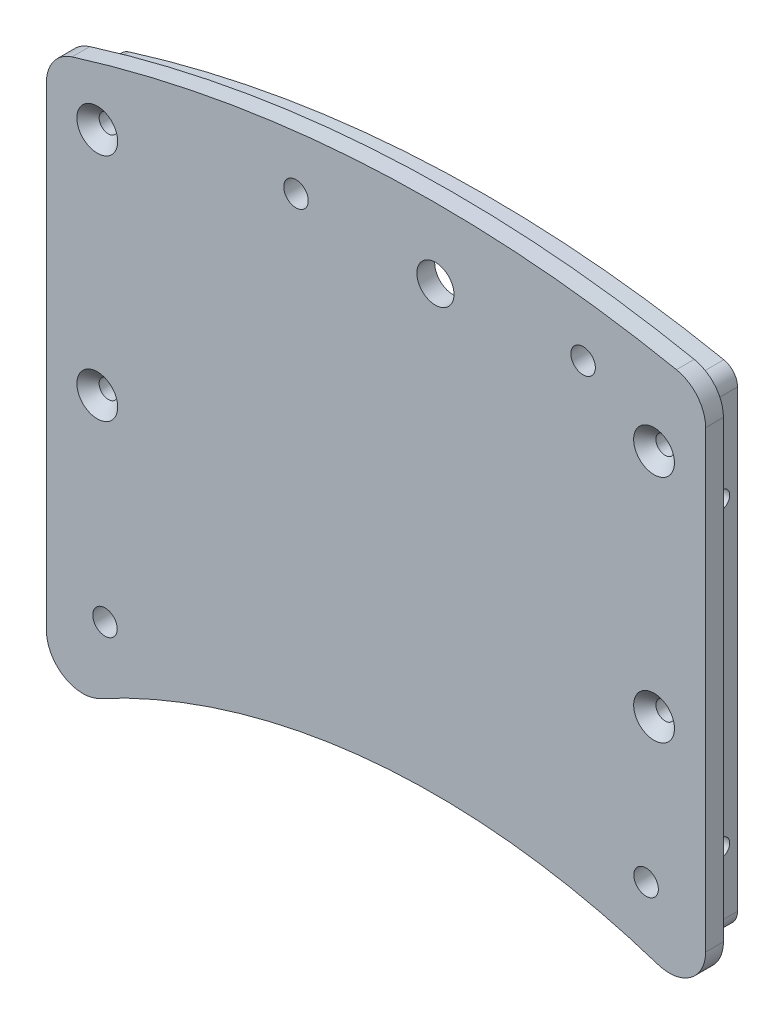
from build123d import *

# Parameters (mm, degrees)
EXTRUDE_446_DEPTH      = 4.5
EXTRUDE_871_DEPTH      = 2.4
SKETCH_7_R             = 1.25
SKETCH_7_R_2           = 2.5
CUT_EXTRUDE_1133_DEPTH = 3
CHAMFER_1178_SIZE      = 1.5
EXTRUDE_START          = 4.5
SKETCH_8_R             = 2.85
SKETCH_8_R_2           = 1.25
EXTRUDE_1547_DEPTH     = 4.5
SKETCH_9_R             = 1.65
CUT_EXTRUDE_1826_DEPTH = 3
SKETCH_13_R            = 1.2
CUT_EXTRUDE_2013_DEPTH = 5
CUT_EXTRUDE_START      = -7
SKETCH_14_R            = 1.2
CUT_EXTRUDE_2216_DEPTH = 7
FILLET_2261_R          = 2


with BuildPart() as part:
    # Эскиз1 → Extrude 446 (new body)
    with BuildSketch(Plane.XY):
        with BuildLine():
            ThreePointArc((-48.184740917, 154.510381185), (-49.352687792, 153.677592944), (-49.8, 152.314674038))
            Line((-49.8, 152.314674038), (-49.8, 88.338690467))
            ThreePointArc((-49.8, 88.338690467), (-48.67998968, 86.364450269), (-46.41076143, 86.312966069))
            ThreePointArc((-46.41076143, 86.312966069), (-8.509697807, 97.629257558), (30.777662843, 93.040971394))
            ThreePointArc((30.777662843, 93.040971394), (32.846964094, 93.360279245), (33.8, 95.224598888))
            Line((33.8, 95.224598888), (33.8, 156.408950918))
            ThreePointArc((33.8, 156.408950918), (33.279664307, 157.865932371), (31.954091345, 158.663679516))
            ThreePointArc((31.954091345, 158.663679516), (-8.376811335, 161.632472551), (-48.184740917, 154.510381185))
        make_face()
        with BuildLine():
            Line((-47.4, 152.241091851), (-47.4, 88.505842281))
            ThreePointArc((-47.4, 88.505842281), (-8.703725392, 100.021444112), (31.4, 95.362907453))
            Line((31.4, 95.362907453), (31.4, 156.32706115))
            ThreePointArc((31.4, 156.32706115), (-8.256741868, 159.235474256), (-47.4, 152.241091851))
        make_face(mode=Mode.SUBTRACT)
    extrude(amount=-EXTRUDE_446_DEPTH)

    # Эскиз2 → Extrude 871 (add)
    with BuildSketch(Plane.XY):
        with BuildLine():
            Line((-52.4, 152.314674038), (-52.4, 88.338690467))
            ThreePointArc((-52.4, 88.338690467), (-50.013891057, 84.132700481), (-45.179448263, 84.023016749))
            ThreePointArc((-45.179448263, 84.023016749), (-8.283928985, 95.039078329), (29.961107796, 90.572522923))
            ThreePointArc((29.961107796, 90.572522923), (34.369619156, 91.252787475), (36.4, 95.224598888))
            Line((36.4, 95.224598888), (36.4, 156.408950918))
            ThreePointArc((36.4, 156.408950918), (35.291458741, 159.512954882), (32.467411995, 161.212503148))
            ThreePointArc((32.467411995, 161.212503148), (-8.511379087, 164.228987816), (-48.958795866, 156.992484917))
            ThreePointArc((-48.958795866, 156.992484917), (-51.447030513, 155.218283882), (-52.4, 152.314674038))
        make_face()
    extrude(amount=EXTRUDE_871_DEPTH)

    # Эскиз7 → Cut-Extrude 1133 (cut)
    with BuildSketch(Plane(origin=(0, 0, 0), x_dir=(-1, 0, 0), z_dir=(0, 0, -1))):
        with Locations((-29.451383649, 150.200294851)):
            Circle(SKETCH_7_R)
        with Locations((45.554851126, 150.200369953)):
            Circle(SKETCH_7_R)
        with Locations((45.55089452, 119.209232592)):
            Circle(SKETCH_7_R)
        with Locations((-29.454420734, 119.20872198)):
            Circle(SKETCH_7_R)
        with Locations((0, 155)):
            Circle(SKETCH_7_R_2)
    extrude(amount=-CUT_EXTRUDE_1133_DEPTH, mode=Mode.SUBTRACT)

    # Chamfer 1178
    chamfer_1178_edges = [part.edges().sort_by_distance(p)[0] for p in [
        (30.704420734, 119.20872198, 2.4),
        (-44.30089452, 119.209232592, 2.4),
        (-44.304851126, 150.200369953, 2.4),
        (30.701383649, 150.200294851, 2.4),
    ]]
    chamfer(chamfer_1178_edges, length=CHAMFER_1178_SIZE)

    # Эскиз8 → Extrude 1547 (add)
    # profile 1 of 4: a face of its own
    with BuildSketch(Plane(origin=(0, 0, 0), x_dir=(-1, 0, 0), z_dir=(0, 0, -1)).offset(EXTRUDE_START)):
        with Locations((-29.454420734, 119.20872198)):
            Circle(SKETCH_8_R)
        with Locations((-29.454420734, 119.20872198)):
            Circle(SKETCH_8_R_2, mode=Mode.SUBTRACT)
    # profile 2 of 4: a face of its own
    with BuildSketch(Plane(origin=(0, 0, 0), x_dir=(-1, 0, 0), z_dir=(0, 0, -1)).offset(EXTRUDE_START)):
        with Locations((-29.451383649, 150.200294851)):
            Circle(SKETCH_8_R)
        with Locations((-29.451383649, 150.200294851)):
            Circle(SKETCH_8_R_2, mode=Mode.SUBTRACT)
    # profile 3 of 4: a face of its own
    with BuildSketch(Plane(origin=(0, 0, 0), x_dir=(-1, 0, 0), z_dir=(0, 0, -1)).offset(EXTRUDE_START)):
        with Locations((45.55089452, 119.209232592)):
            Circle(SKETCH_8_R)
        with Locations((45.55089452, 119.209232592)):
            Circle(SKETCH_8_R_2, mode=Mode.SUBTRACT)
    # profile 4 of 4: a face of its own
    with BuildSketch(Plane(origin=(0, 0, 0), x_dir=(-1, 0, 0), z_dir=(0, 0, -1)).offset(EXTRUDE_START)):
        with Locations((45.554851126, 150.200369953)):
            Circle(SKETCH_8_R)
        with Locations((45.554851126, 150.200369953)):
            Circle(SKETCH_8_R_2, mode=Mode.SUBTRACT)
    extrude(amount=-EXTRUDE_1547_DEPTH)

    # Эскиз9 → Cut-Extrude 1826 (cut)
    with BuildSketch(Plane(origin=(0, 0, 0), x_dir=(-1, 0, 0), z_dir=(0, 0, -1))):
        with Locations((-28.380750513, 99.381741539)):
            Circle(SKETCH_9_R)
        with Locations((44.512478568, 93.278276156)):
            Circle(SKETCH_9_R)
        with Locations((-19.894937989, 155.969982116)):
            Circle(SKETCH_9_R)
        with Locations((18.78344627, 156.107738518)):
            Circle(SKETCH_9_R)
    extrude(amount=-CUT_EXTRUDE_1826_DEPTH, mode=Mode.SUBTRACT)

    # Эскиз13 → Cut-Extrude 2013 (cut)
    with BuildSketch(Plane.ZY.offset(49.8)):
        with Locations((-2.25, 144.314674038)):
            Circle(SKETCH_13_R)
        with Locations((-2.25, 91.438690467)):
            Circle(SKETCH_13_R)
    extrude(amount=-CUT_EXTRUDE_2013_DEPTH, mode=Mode.SUBTRACT)

    # Эскиз14 → Cut-Extrude 2216 (cut)
    with BuildSketch(Plane(origin=(33.8, 0, 0), x_dir=(0, 0, -1), z_dir=(1, 0, 0)).offset(CUT_EXTRUDE_START)):
        with Locations(Location((2.25, 144.314674038, 0), (0, 0, 180))):
            Circle(SKETCH_14_R)
        with Locations(Location((2.25, 103.724598888, 0), (0, 0, 90))):
            Circle(SKETCH_14_R)
    extrude(amount=CUT_EXTRUDE_2216_DEPTH, mode=Mode.SUBTRACT)

    # Fillet 2261
    # the kernel refuses this fillet: 2 mm, written as the material it adds along each edge
    with BuildSketch(Plane(origin=(-44.944004027, 152.98413823, -4.5), x_dir=(0.9624896485032316, 0.2713184043225332, 0), z_dir=(0, 0, 1))) as fillet_2261_piece_1:
        with BuildLine():
            CenterArc((3.479493085, -1.99987944), FILLET_2261_R, 89.370889764, 96.709553608)
            ThreePointArc((1.490744771, -2.21172878), (1.020072901, -0.920711328), (0, 0))
            ThreePointArc((0, 0), (1.750726367, 0.009611624), (3.501452734, 0))
        make_face()
    extrude(amount=4.5)
    with BuildSketch(Plane(origin=(31.4, 156.32706115, 0), x_dir=(0, -1, 0), z_dir=(0, 0, -1))) as fillet_2261_piece_2:
        with BuildLine():
            CenterArc((1.646899326, 2), FILLET_2261_R, 190.761817139, 79.238182861)
            ThreePointArc((-0.317924487, 1.626546679), (-0.16107556, 0.812860271), (0, 0))
            Line((0, 0), (1.646899326, 0))
        make_face()
    extrude(amount=4.5)
    with BuildSketch(Plane(origin=(31.4, 95.362907453, 0), x_dir=(0, 1, 0), z_dir=(0, 0, -1))) as fillet_2261_piece_3:
        with BuildLine():
            CenterArc((2.725225415, -2), FILLET_2261_R, 90, 106.685074195)
            ThreePointArc((0.809430773, -2.574221986), (0.413364342, -1.284391441), (0, 0))
            Line((0, 0), (2.725225415, 0))
        make_face()
    extrude(amount=4.5)
    with BuildSketch(Plane(origin=(-47.4, 88.505842281, 0), x_dir=(0.889056274455369, 0.45779792578335204, 0), z_dir=(0, 0, -1))) as fillet_2261_piece_4_section:
        with BuildLine():
            CenterArc((3.279293139, -1.999738508), FILLET_2261_R, 90.92652325, 116.318579463)
            Line((1.50118059, -2.91533436), (0, 0))
            ThreePointArc((0, 0), (1.623476393, -0.013126808), (3.246952786, 0))
        make_face()
    fillet_2261_piece_4 = extrude(amount=4.5, mode=Mode.PRIVATE)
    fillet_2261_piece_4 = fillet_2261_piece_4 - Plane(origin=(-46.674755075, 91.438690467, -2.25), x_dir=(0, 0, 1), z_dir=(-1, 0, 0)) * Cylinder(1.2, 22, mode=Mode.PRIVATE)
    add(fillet_2261_piece_4)


solid = part.part
